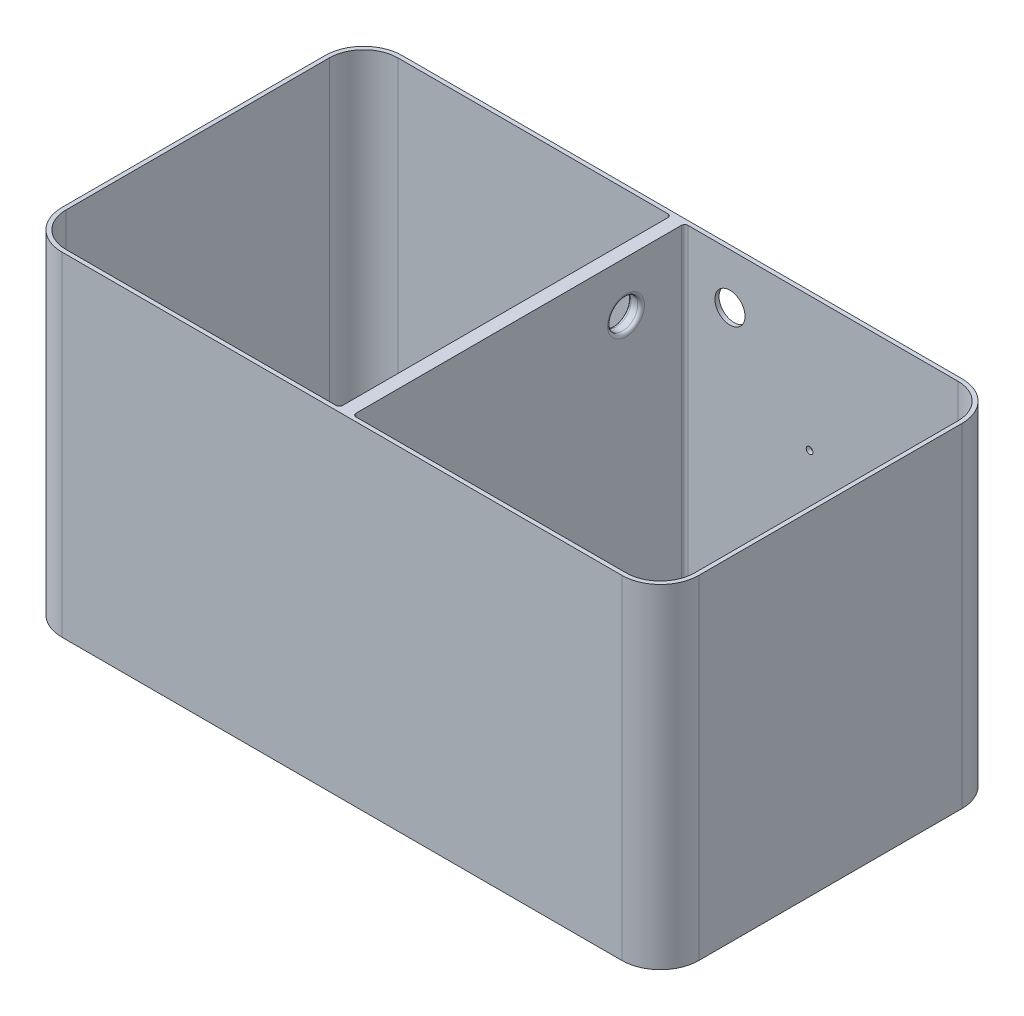
from build123d import *

# Parameters (mm, degrees)
EXTRUDE_1_DEPTH     = 199
CUT_EXTRUDE_1_DEPTH = 195
SKETCH_4_W          = 8
SKETCH_4_H          = 198
EXTRUDE_2_DEPTH     = 195
FILLET_1_R          = 2
CUT_EXTRUDE_2_REACH = 343.921
SKETCH_6_R          = 2
SKETCH_6_R_2        = 9
CUT_EXTRUDE_3_REACH = 297.87
SKETCH_7_R          = 9
FILLET_2_R          = 2


with BuildPart() as part:
    # 草图1 → 凸台-拉伸1 (new body)
    with BuildSketch(Plane(origin=(0, 0, 0), x_dir=(1, 0, 0), z_dir=(0, 1, 0))):
        with BuildLine():
            Line((-167, 101.5), (167, 101.5))
            ThreePointArc((167, 101.5), (183.263455967, 94.763455967), (190, 78.5))
            Line((190, 78.5), (190, -78.5))
            ThreePointArc((190, -78.5), (183.263455967, -94.763455967), (167, -101.5))
            Line((167, -101.5), (-167, -101.5))
            ThreePointArc((-167, -101.5), (-183.263455967, -94.763455967), (-190, -78.5))
            Line((-190, -78.5), (-190, 78.5))
            ThreePointArc((-190, 78.5), (-183.263455967, 94.763455967), (-167, 101.5))
        make_face()
    extrude(amount=EXTRUDE_1_DEPTH)

    # 草图3 → 切除-拉伸1 (cut)
    with BuildSketch(Plane(origin=(0, 199, 0), x_dir=(1, 0, 0), z_dir=(0, 1, 0))):
        with BuildLine():
            Line((-167, 99), (167, 99))
            ThreePointArc((167, 99), (181.495689014, 92.995689014), (187.5, 78.5))
            Line((187.5, 78.5), (187.5, -78.5))
            ThreePointArc((187.5, -78.5), (181.495689014, -92.995689014), (167, -99))
            Line((167, -99), (-167, -99))
            ThreePointArc((-167, -99), (-181.495689014, -92.995689014), (-187.5, -78.5))
            Line((-187.5, -78.5), (-187.5, 78.5))
            ThreePointArc((-187.5, 78.5), (-181.495689014, 92.995689014), (-167, 99))
        make_face()
    extrude(amount=-CUT_EXTRUDE_1_DEPTH, mode=Mode.SUBTRACT)

    # 草图4 → 凸台-拉伸2 (add)
    with BuildSketch(Plane(origin=(0, 4, 0), x_dir=(1, 0, 0), z_dir=(0, 1, 0))):
        Rectangle(SKETCH_4_W, SKETCH_4_H)
    extrude(amount=EXTRUDE_2_DEPTH)

    # 圆角1
    fillet_1_edges = [part.edges().sort_by_distance(p)[0] for p in [
        (85.5, 4, 99),
        (181.495689014, 4, 92.995689014),
        (187.5, 4, 0),
        (181.495689014, 4, -92.995689014),
        (-85.5, 4, 99),
        (-181.495689014, 4, 92.995689014),
        (-187.5, 4, 0),
        (-181.495689014, 4, -92.995689014),
        (-4, 101.5, -99),
        (-4, 4, 0),
        (-4, 101.5, 99),
        (4, 101.5, 99),
        (4, 101.5, -99),
        (4, 4, 0),
        (85.5, 4, -99),
        (-85.5, 4, -99),
    ]]
    fillet(fillet_1_edges, radius=FILLET_1_R)

    # 草图6 → 切除-拉伸2 (cut, up to next)
    with BuildSketch(Plane(origin=(0, 0, -101.5), x_dir=(-1, 0, 0), z_dir=(0, 0, -1)), mode=Mode.PRIVATE) as cut_extrude_2_sk1:
        with Locations((-155, 119)):
            Circle(SKETCH_6_R)
    cut_extrude_2_tool1 = extrude(cut_extrude_2_sk1.sketch, amount=-CUT_EXTRUDE_2_REACH, mode=Mode.PRIVATE) & part.part
    # 草图6 → 切除-拉伸2 (cut, up to next)
    with BuildSketch(Plane(origin=(0, 0, -101.5), x_dir=(-1, 0, 0), z_dir=(0, 0, -1)), mode=Mode.PRIVATE) as cut_extrude_2_sk2:
        with Locations((-155, 64)):
            Circle(SKETCH_6_R)
    cut_extrude_2_tool2 = extrude(cut_extrude_2_sk2.sketch, amount=-CUT_EXTRUDE_2_REACH, mode=Mode.PRIVATE) & part.part
    # 草图6 → 切除-拉伸2 (cut, up to next)
    with BuildSketch(Plane(origin=(0, 0, -101.5), x_dir=(-1, 0, 0), z_dir=(0, 0, -1)), mode=Mode.PRIVATE) as cut_extrude_2_sk3:
        with Locations((-78.5, 64)):
            Circle(SKETCH_6_R)
    cut_extrude_2_tool3 = extrude(cut_extrude_2_sk3.sketch, amount=-CUT_EXTRUDE_2_REACH, mode=Mode.PRIVATE) & part.part
    # 草图6 → 切除-拉伸2 (cut, up to next)
    with BuildSketch(Plane(origin=(0, 0, -101.5), x_dir=(-1, 0, 0), z_dir=(0, 0, -1)), mode=Mode.PRIVATE) as cut_extrude_2_sk4:
        with Locations((-78.5, 119)):
            Circle(SKETCH_6_R)
    cut_extrude_2_tool4 = extrude(cut_extrude_2_sk4.sketch, amount=-CUT_EXTRUDE_2_REACH, mode=Mode.PRIVATE) & part.part
    # 草图6 → 切除-拉伸2 (cut, up to next)
    with BuildSketch(Plane(origin=(0, 0, -101.5), x_dir=(-1, 0, 0), z_dir=(0, 0, -1)), mode=Mode.PRIVATE) as cut_extrude_2_sk5:
        with Locations((-31, 169)):
            Circle(SKETCH_6_R_2)
    cut_extrude_2_tool5 = extrude(cut_extrude_2_sk5.sketch, amount=-CUT_EXTRUDE_2_REACH, mode=Mode.PRIVATE) & part.part
    add(cut_extrude_2_tool1.solids().sort_by_distance((155, 119, -101.5))[0], mode=Mode.SUBTRACT)
    add(cut_extrude_2_tool2.solids().sort_by_distance((155, 64, -101.5))[0], mode=Mode.SUBTRACT)
    add(cut_extrude_2_tool3.solids().sort_by_distance((78.5, 64, -101.5))[0], mode=Mode.SUBTRACT)
    add(cut_extrude_2_tool4.solids().sort_by_distance((78.5, 119, -101.5))[0], mode=Mode.SUBTRACT)
    add(cut_extrude_2_tool5.solids().sort_by_distance((31, 169, -101.5))[0], mode=Mode.SUBTRACT)

    # 草图7 → 切除-拉伸3 (cut, up to next)
    with BuildSketch(Plane(origin=(4, 0, 0), x_dir=(0, 0, -1), z_dir=(1, 0, 0)), mode=Mode.PRIVATE) as cut_extrude_3_sk1:
        with Locations((64, 169)):
            Circle(SKETCH_7_R)
    cut_extrude_3_tool1 = extrude(cut_extrude_3_sk1.sketch, amount=-CUT_EXTRUDE_3_REACH, mode=Mode.PRIVATE) & part.part
    add(cut_extrude_3_tool1.solids().sort_by_distance((4, 169, -64))[0], mode=Mode.SUBTRACT)

    # 圆角2
    fillet_2_edges = [part.edges().sort_by_distance(p)[0] for p in [
        (-4, 169, -55),
        (4, 169, -55),
    ]]
    fillet(fillet_2_edges, radius=FILLET_2_R)


solid = part.part
